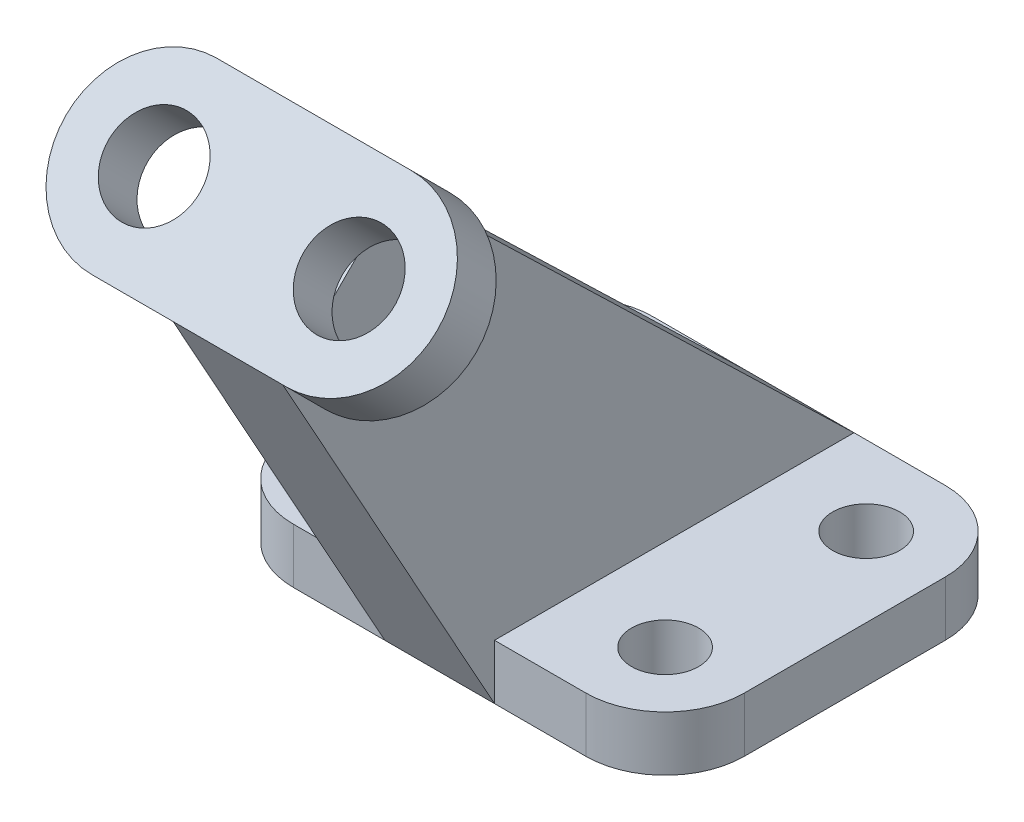
from build123d import *

# Parameters (mm, degrees)
SKETCH1_W            = 74
SKETCH1_H            = 59
EXTRUDE1_DEPTH       = 9
SKETCH2_R            = 5.5
CUT_EXTRUDE1_DEPTH   = 49.493093283
LPATTERN1_COUNT      = 2
LPATTERN1_PITCH      = 48
LPATTERN1_COUNT_DIR2 = 2
LPATTERN1_PITCH_DIR2 = 33
RIB2_START           = -9
RIB2_DEPTH           = 18
EXTRUDE2_DEPTH       = 9
SKETCH7_R            = 7.5
CUT_EXTRUDE2_DEPTH   = 9
FILLET8_R            = 13


# Read off the part's stored shape, not the designer's step: Rib2
with BuildPart() as part:
    # Sketch1 → Extrude1 (new body)
    with BuildSketch(Plane(origin=(0, 0, 0), x_dir=(1, 0, 0), z_dir=(0, 1, 0))):
        with Locations((0.345335821, 0.095708955)):
            Rectangle(SKETCH1_W, SKETCH1_H)
    extrude(amount=EXTRUDE1_DEPTH)

    # Sketch2 → Cut-Extrude1 (cut, through all)
    with BuildSketch(Plane(origin=(0, 9, 0), x_dir=(-1, 0, 0), z_dir=(0, 1, 0))):
        with Locations(Location((23.654664179, -16.595708955, 0), (0, 0, 90))):
            Circle(SKETCH2_R)
    cut_extrude1 = extrude(amount=-CUT_EXTRUDE1_DEPTH, mode=Mode.SUBTRACT)

    # LPattern1: Cut-Extrude1 2 × 2
    with Locations(*[(i * LPATTERN1_PITCH, 0, j * LPATTERN1_PITCH_DIR2) for i in range(LPATTERN1_COUNT) for j in range(LPATTERN1_COUNT_DIR2) if (i, j) != (0, 0)]):
        add(cut_extrude1, mode=Mode.SUBTRACT)

    # Rib2 outline → Rib2 (add)
    with BuildSketch(Plane(origin=(0.35, 0, 0), x_dir=(0, 0, -1), z_dir=(1, 0, 0)).offset(RIB2_START)):
        Polygon((29.595708955, 9), (-45.389590013, 81.412461489), (-64.138992076, 62.663059426), (-29.404291045, 0), (-29.404291045, 9), align=None)
    extrude(amount=RIB2_DEPTH)

    # Sketch6 → Extrude2 (add)
    with BuildSketch(Plane(origin=(0, 63.401025751, 63.401025751), x_dir=(1, 0, 0), z_dir=(0, 0.7071067811865438, 0.7071067811865513))):
        with BuildLine():
            Line((16.35, 27.956358014), (-15.65, 27.956358014))
            ThreePointArc((-15.65, 27.956358014), (-30.15, 13.456358014), (-15.65, -1.043641986))
            Line((-15.65, -1.043641986), (16.35, -1.043641986))
            ThreePointArc((16.35, -1.043641986), (30.85, 13.456358014), (16.35, 27.956358014))
        make_face()
    extrude(amount=EXTRUDE2_DEPTH)

    # Sketch7 → Cut-Extrude2 (cut)
    with BuildSketch(Plane(origin=(0, 69.764986782, 69.764986782), x_dir=(1, 0, 0), z_dir=(0, 0.7071067811865438, 0.7071067811865512))):
        with Locations(Location((16.35, 13.456358014, 0), (0, 0, 270))):
            Circle(SKETCH7_R)
        with Locations(Location((-15.65, 13.456358014, 0), (0, 0, 270))):
            Circle(SKETCH7_R)
    extrude(amount=-CUT_EXTRUDE2_DEPTH, mode=Mode.SUBTRACT)

    # Fillet8
    fillet8_edges = [part.edges().sort_by_distance(p)[0] for p in [
        (-36.654664179, 4.5, -29.595708955),
        (37.345335821, 4.5, -29.595708955),
        (37.345335821, 4.5, 29.404291045),
        (-36.654664179, 4.5, 29.404291045),
    ]]
    fillet(fillet8_edges, radius=FILLET8_R)


solid = part.part
